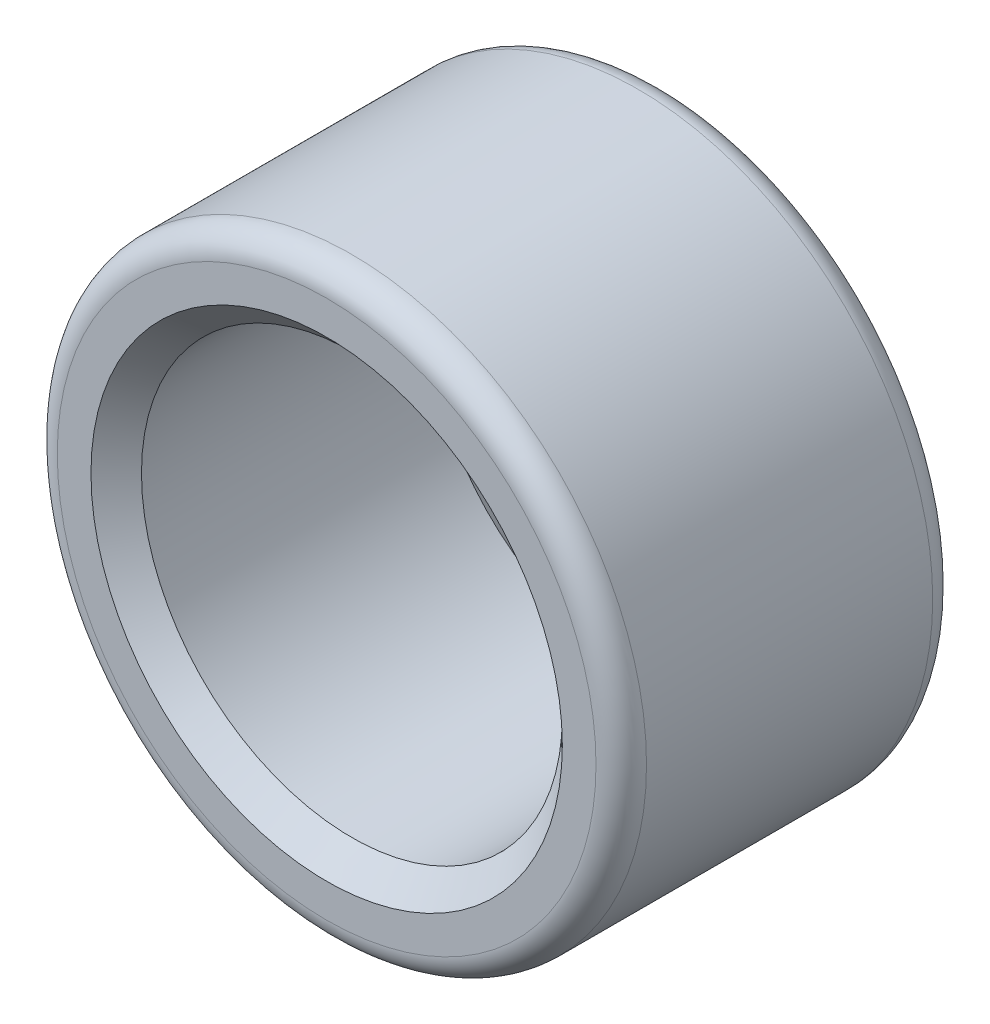
from build123d import *

# Parameters (mm, degrees)
SKETCH1_R           = 3.5
SKETCH1_R_2         = 2.5
BOSS_EXTRUDE1_DEPTH = 2
CHAMFER1_SIZE       = 0.3
FILLET1_R           = 0.3


with BuildPart() as part:
    # Sketch1 → Boss-Extrude1 (new, symmetric)
    with BuildSketch(Plane.XY):
        Circle(SKETCH1_R)
        Circle(SKETCH1_R_2, mode=Mode.SUBTRACT)
    extrude(amount=BOSS_EXTRUDE1_DEPTH, both=True)

    # Chamfer1
    chamfer1_edges = [part.edges().sort_by_distance(p)[0] for p in [
        (-2.5, 0, -2),
        (-2.5, 0, 2),
    ]]
    chamfer(chamfer1_edges, length=CHAMFER1_SIZE)

    # Fillet1
    fillet1_edges = [part.edges().sort_by_distance(p)[0] for p in [
        (-3.5, 0, -2),
        (-3.5, 0, 2),
    ]]
    fillet(fillet1_edges, radius=FILLET1_R)


solid = part.part
